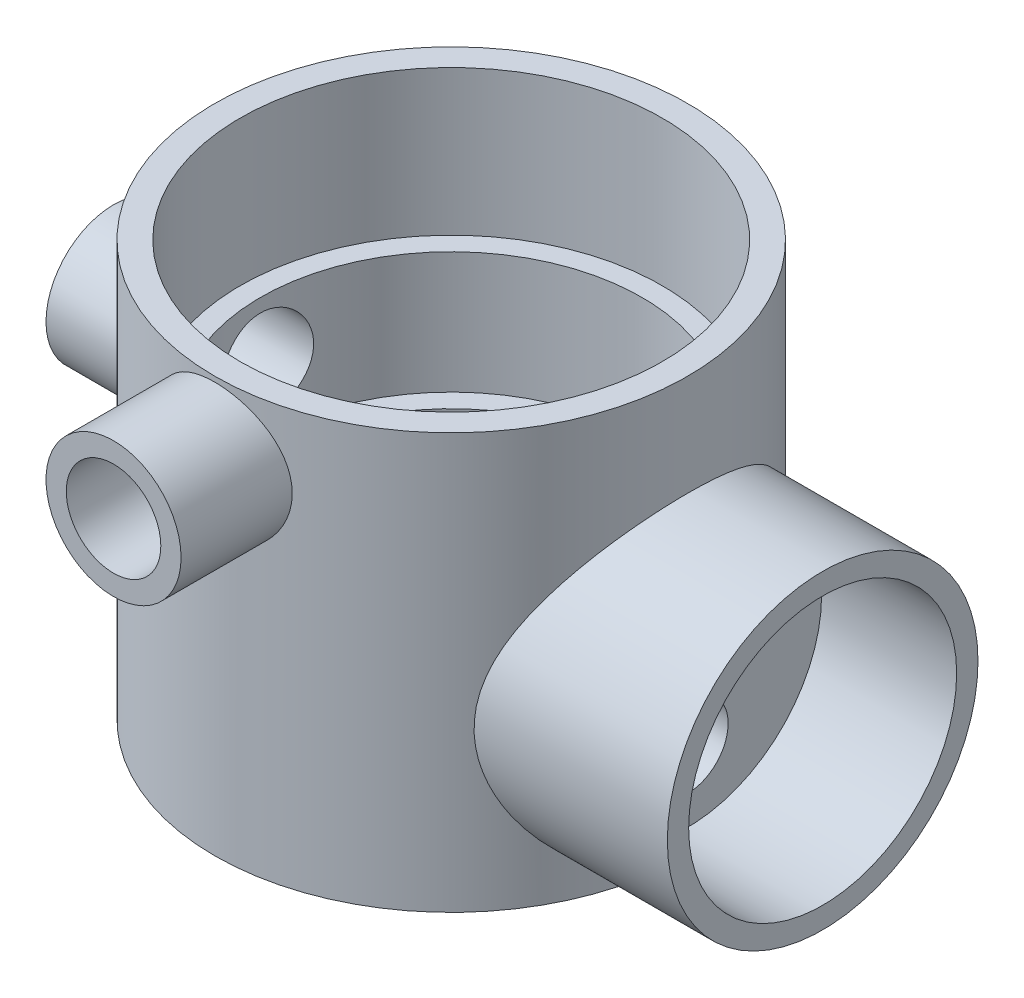
from build123d import *

# Parameters (mm, degrees)
SKETCH1_R                = 35
BOSS_EXTRUDE1_DEPTH      = 4
SKETCH2_R                = 7.8
BOSS_EXTRUDE2_DEPTH      = 2
SKETCH3_R                = 35
SKETCH3_R_2              = 25.25
BOSS_EXTRUDE3_DEPTH      = 18
SKETCH4_R                = 35
SKETCH4_R_2              = 28.25
BOSS_EXTRUDE4_DEPTH      = 18
SKETCH5_R                = 35
SKETCH5_R_2              = 31.25
BOSS_EXTRUDE5_DEPTH      = 21.5
BOSS_EXTRUDE7_REACH      = 116.487
SKETCH7_R                = 23
SKETCH10_R               = 19.84375
CUT_EXTRUDE1_DEPTH       = 20
CUT_EXTRUDE2_REACH       = 101.535
SKETCH11_R               = 6
BOSS_EXTRUDE8_REACH      = 128.619
SKETCH12_R               = 10
CUT_EXTRUDE3_REACH       = 128.619
SKETCH13_R               = 7
BOSS_EXTRUDE9_REACH      = 120.458
BOSS_EXTRUDE9_END_RADIUS = 35
SKETCH14_R               = 10
CUT_EXTRUDE4_REACH       = 120.458
SKETCH15_R               = 7


with BuildPart() as part:
    # Sketch1 → Boss-Extrude1 (new body)
    with BuildSketch(Plane(origin=(0, 0, 0), x_dir=(1, 0, 0), z_dir=(0, 1, 0))):
        Circle(SKETCH1_R)
    extrude(amount=BOSS_EXTRUDE1_DEPTH)

    # Sketch2 → Boss-Extrude2 (add)
    with BuildSketch(Plane(origin=(0, 4, 0), x_dir=(1, 0, 0), z_dir=(0, 1, 0))):
        Circle(SKETCH2_R)
    extrude(amount=BOSS_EXTRUDE2_DEPTH)

    # Sketch3 → Boss-Extrude3 (add)
    with BuildSketch(Plane(origin=(0, 4, 0), x_dir=(1, 0, 0), z_dir=(0, 1, 0))):
        Circle(SKETCH3_R)
        Circle(SKETCH3_R_2, mode=Mode.SUBTRACT)
    extrude(amount=BOSS_EXTRUDE3_DEPTH)

    # Sketch4 → Boss-Extrude4 (add)
    with BuildSketch(Plane(origin=(0, 22, 0), x_dir=(1, 0, 0), z_dir=(0, 1, 0))):
        Circle(SKETCH4_R)
        Circle(SKETCH4_R_2, mode=Mode.SUBTRACT)
    extrude(amount=BOSS_EXTRUDE4_DEPTH)

    # Sketch5 → Boss-Extrude5 (add)
    with BuildSketch(Plane(origin=(0, 40, 0), x_dir=(1, 0, 0), z_dir=(0, 1, 0))):
        Circle(SKETCH5_R)
        Circle(SKETCH5_R_2, mode=Mode.SUBTRACT)
    extrude(amount=BOSS_EXTRUDE5_DEPTH)

    # Sketch7 → Boss-Extrude7 (add, up to next)
    with BuildSketch(Plane(origin=(55, 0, 0), x_dir=(0, 0, -1), z_dir=(1, 0, 0)), mode=Mode.PRIVATE) as boss_extrude7_sk1:
        with Locations((0, 23.5)):
            Circle(SKETCH7_R)
    boss_extrude7_tool1 = extrude(boss_extrude7_sk1.sketch, amount=-BOSS_EXTRUDE7_REACH, mode=Mode.PRIVATE) - part.part
    add(boss_extrude7_tool1.solids().sort_by_distance((55, 23.5, 0))[0])

    # Sketch10 → Cut-Extrude1 (cut)
    with BuildSketch(Plane(origin=(55, 0, 0), x_dir=(0, 0, -1), z_dir=(1, 0, 0))):
        with Locations((0, 23.5)):
            Circle(SKETCH10_R)
    extrude(amount=-CUT_EXTRUDE1_DEPTH, mode=Mode.SUBTRACT)

    # Sketch11 → Cut-Extrude2 (cut, up to next)
    with BuildSketch(Plane(origin=(35, 0, 0), x_dir=(0, 0, -1), z_dir=(1, 0, 0)), mode=Mode.PRIVATE) as cut_extrude2_sk1:
        with Locations((0, 14)):
            Circle(SKETCH11_R)
    cut_extrude2_tool1 = extrude(cut_extrude2_sk1.sketch, amount=-CUT_EXTRUDE2_REACH, mode=Mode.PRIVATE) & part.part
    add(cut_extrude2_tool1.solids().sort_by_distance((35, 14, 0))[0], mode=Mode.SUBTRACT)

    # Sketch12 → Boss-Extrude8 (add, up to next)
    with BuildSketch(Plane(origin=(-50, 0, 0), x_dir=(0, 0, -1), z_dir=(1, 0, 0)), mode=Mode.PRIVATE) as boss_extrude8_sk1:
        with Locations((0, 31)):
            Circle(SKETCH12_R)
    boss_extrude8_tool1 = extrude(boss_extrude8_sk1.sketch, amount=BOSS_EXTRUDE8_REACH, mode=Mode.PRIVATE) - part.part
    add(boss_extrude8_tool1.solids().sort_by_distance((-50, 31, 0))[0])

    # Sketch13 → Cut-Extrude3 (cut, up to next)
    with BuildSketch(Plane.ZY.offset(50), mode=Mode.PRIVATE) as cut_extrude3_sk1:
        with Locations((0, 31)):
            Circle(SKETCH13_R)
    cut_extrude3_tool1 = extrude(cut_extrude3_sk1.sketch, amount=-CUT_EXTRUDE3_REACH, mode=Mode.PRIVATE) & part.part
    add(cut_extrude3_tool1.solids().sort_by_distance((-50, 31, 0))[0], mode=Mode.SUBTRACT)

    # Boss-Extrude9: up to this cylinder (the profile starts outside it)
    boss_extrude9_end = Plane(origin=(0, 50.75, 0), z_dir=(0, -1, 0)) * Cylinder(BOSS_EXTRUDE9_END_RADIUS, 311.916, mode=Mode.PRIVATE)
    # Sketch14 → Boss-Extrude9 (add, up to the surface)
    with BuildSketch(Plane.XY.offset(50), mode=Mode.PRIVATE) as boss_extrude9_sk1:
        with Locations((0, 50.75)):
            Circle(SKETCH14_R)
    boss_extrude9_tool1 = extrude(boss_extrude9_sk1.sketch, amount=-BOSS_EXTRUDE9_REACH, mode=Mode.PRIVATE) - boss_extrude9_end
    add(boss_extrude9_tool1.solids().sort_by_distance((0, 50.75, 50))[0])

    # Sketch15 → Cut-Extrude4 (cut, up to next)
    with BuildSketch(Plane.XY.offset(50), mode=Mode.PRIVATE) as cut_extrude4_sk1:
        with Locations((0, 50.75)):
            Circle(SKETCH15_R)
    cut_extrude4_tool1 = extrude(cut_extrude4_sk1.sketch, amount=-CUT_EXTRUDE4_REACH, mode=Mode.PRIVATE) & part.part
    add(cut_extrude4_tool1.solids().sort_by_distance((0, 50.75, 50))[0], mode=Mode.SUBTRACT)


solid = part.part
